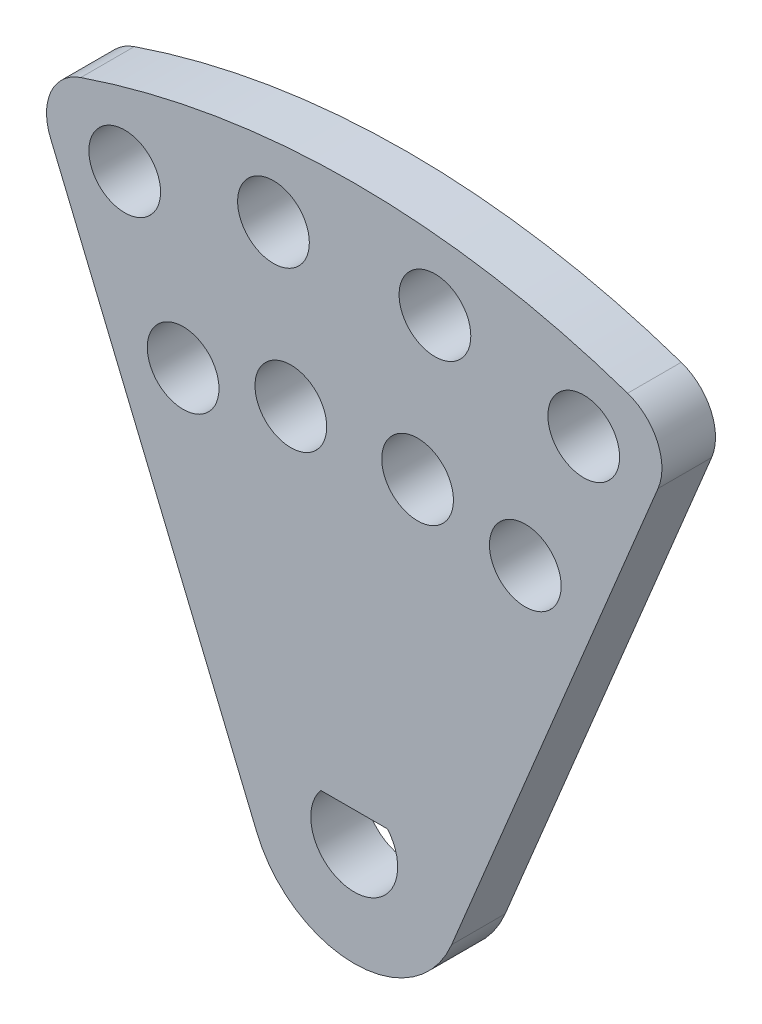
from build123d import *

# Parameters (mm, degrees)
SKETCH2_R           = 4.25
BOSS_EXTRUDE1_DEPTH = 6.35
FILLET1_R           = 6


with BuildPart() as part:
    # Sketch2 → Boss-Extrude1 (new body)
    with BuildSketch(Plane.XY):
        with BuildLine():
            Line((11.548494156, -4.783542905), (38.382716246, 60))
            ThreePointArc((38.382716246, 60), (0, 67.634796955), (-38.382716246, 60))
            Line((-38.382716246, 60), (-11.548494156, -4.783542905))
            ThreePointArc((-11.548494156, -4.783542905), (0, -12.5), (11.548494156, -4.783542905))
        make_face()
        with Locations((-27.203312061, 55.222101201)):
            Circle(SKETCH2_R, mode=Mode.SUBTRACT)
        with Locations((-9.56999846, 58.836828221)):
            Circle(SKETCH2_R, mode=Mode.SUBTRACT)
        with Locations((9.56999846, 58.836828221)):
            Circle(SKETCH2_R, mode=Mode.SUBTRACT)
        with Locations((27.203312061, 55.222101201)):
            Circle(SKETCH2_R, mode=Mode.SUBTRACT)
        with Locations((-20.278160914, 38.503307381)):
            Circle(SKETCH2_R, mode=Mode.SUBTRACT)
        with Locations((-7.511195711, 40.953735809)):
            Circle(SKETCH2_R, mode=Mode.SUBTRACT)
        with Locations((7.511195711, 40.953735809)):
            Circle(SKETCH2_R, mode=Mode.SUBTRACT)
        with Locations((20.278160914, 38.503307381)):
            Circle(SKETCH2_R, mode=Mode.SUBTRACT)
        with BuildLine():
            Line((-3.953795645, 3.3), (3.953795645, 3.3))
            ThreePointArc((3.953795645, 3.3), (0, -5.15), (-3.953795645, 3.3))
        make_face(mode=Mode.SUBTRACT)
    extrude(amount=BOSS_EXTRUDE1_DEPTH)

    # Fillet1
    fillet1_edges = [part.edges().sort_by_distance(p)[0] for p in [
        (38.382716246, 60, 3.175),
        (-38.382716246, 60, 3.175),
    ]]
    fillet(fillet1_edges, radius=FILLET1_R)


solid = part.part
